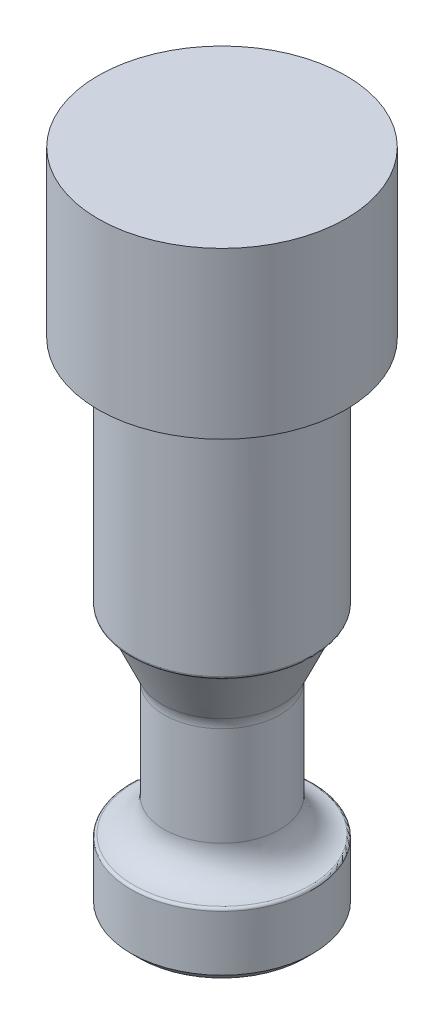
from build123d import *

# Parameters (mm, degrees)
SKETCH1_R               = 8.73125
MAIN_DEPTH              = 47.625
CHAMFER1_SIZE           = 0.79375
FILLET1_R               = 0.254
SKETCH6_R               = 11.90625
SPRING_STABILIZER_DEPTH = 15.875


with BuildPart() as part:
    # Sketch1 → main (new body)
    with BuildSketch(Plane(origin=(0, 0, 0), x_dir=(1, 0, 0), z_dir=(0, 1, 0))):
        Circle(SKETCH1_R)
    extrude(amount=MAIN_DEPTH)

    # Chamfer1
    chamfer1_edges = [part.edges().sort_by_distance(p)[0] for p in [
        (-8.73125, 0, 0),
    ]]
    chamfer(chamfer1_edges, length=CHAMFER1_SIZE)

    # Sketch2 → ball_channel (revolve, cut)
    with BuildSketch(Plane(origin=(0, 0, 0), x_dir=(0, 0, -1), z_dir=(1, 0, 0))):
        with BuildLine():
            ThreePointArc((-8.009313581, 24.93617028), (-8.302201361, 25.274050408), (-8.73125, 25.400000791))
            Line((-8.73125, 25.400000791), (-8.73125, 6.350000791))
            ThreePointArc((-8.73125, 6.350000791), (-6.48618597, 7.279936761), (-5.55625, 9.525000791))
            Line((-5.55625, 9.525000791), (-5.55625, 19.050000791))
            ThreePointArc((-5.55625, 19.050000791), (-5.610733482, 19.556468098), (-5.771690742, 20.039759257))
            Line((-5.771690742, 20.039759257), (-8.009313581, 24.93617028))
        make_face()
    revolve(axis=Axis((0, 47.625, 0), (0, -1, 0)), mode=Mode.SUBTRACT)

    # Fillet1
    fillet1_edges = [part.edges().sort_by_distance(p)[0] for p in [
        (-6.173926083, 25.400000791, -6.173926083),
        (6.173926083, 6.350000791, 6.173926083),
    ]]
    fillet(fillet1_edges, radius=FILLET1_R)

    # Sketch6 → spring_stabilizer (add)
    with BuildSketch(Plane(origin=(0, 47.625, 0), x_dir=(1, 0, 0), z_dir=(0, 1, 0))):
        Circle(SKETCH6_R)
    extrude(amount=SPRING_STABILIZER_DEPTH)


solid = part.part
